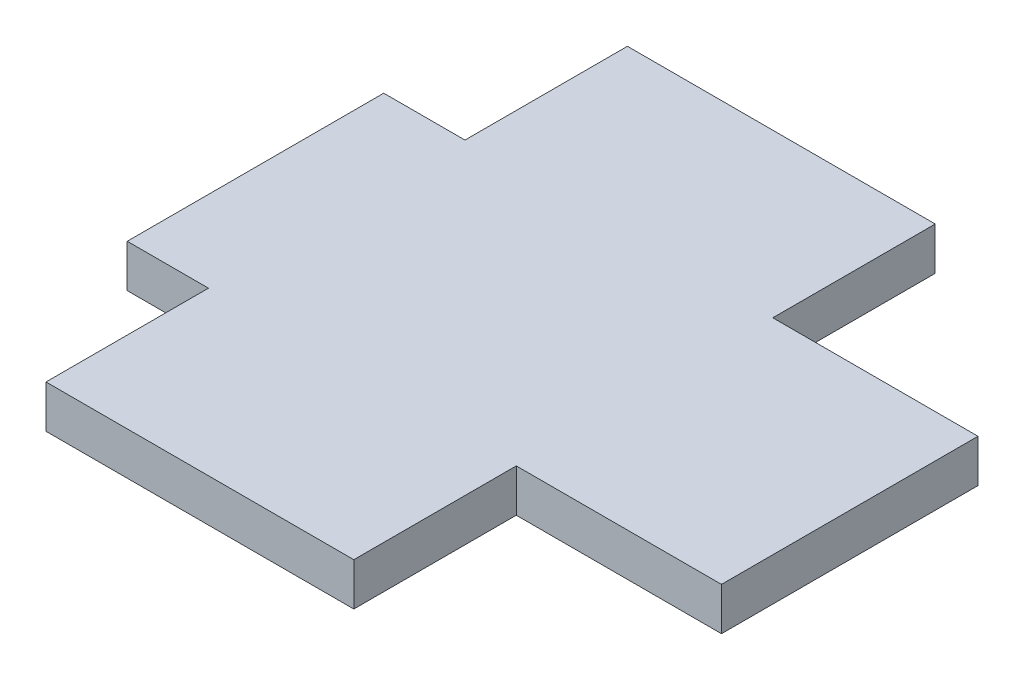
from build123d import *

# Parameters (mm, degrees)
BOSS_EXTRUDE1_DEPTH = 3.175


with BuildPart() as part:
    # Sketch1 → Boss-Extrude1 (new body)
    with BuildSketch(Plane(origin=(0, 0, 0), x_dir=(1, 0, 0), z_dir=(0, 1, 0))):
        Polygon((0, 0), (22.86, 0), (22.86, 12.065), (38.1, 12.065), (38.1, 31.115), (22.86, 31.115), (22.86, 43.18), (0, 43.18), (0, 31.115), (-6.0325, 31.115), (-6.0325, 12.065), (0, 12.065), align=None)
    extrude(amount=BOSS_EXTRUDE1_DEPTH)


solid = part.part
